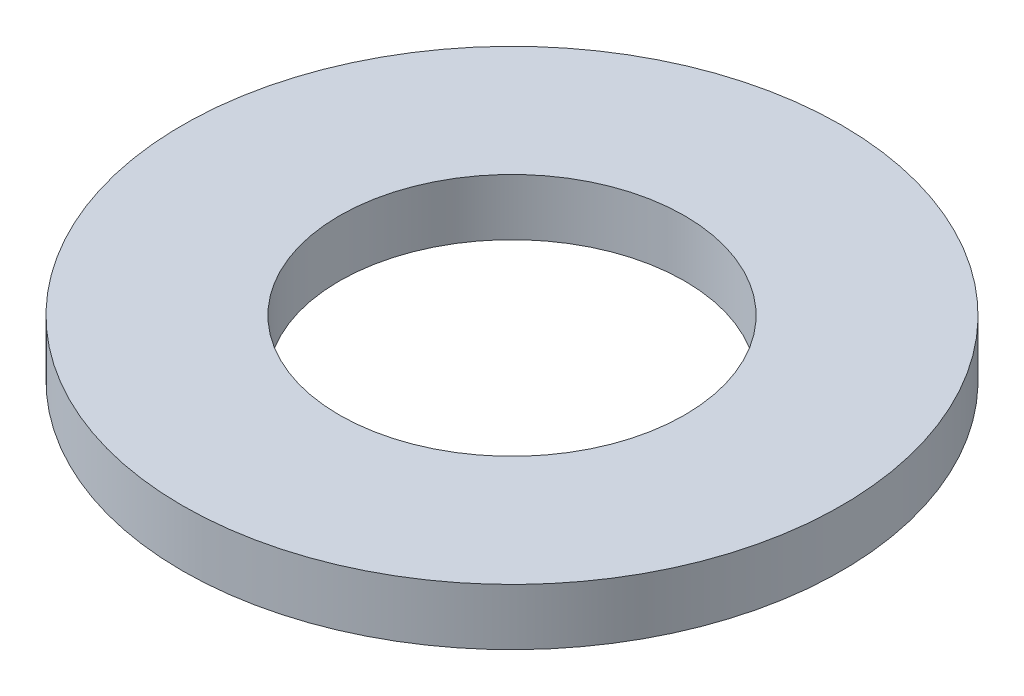
from build123d import *

# Parameters (mm, degrees)
SKETCH1_R           = 52.5
BOSS_EXTRUDE1_DEPTH = 9
SKETCH2_R           = 27.5
CUT_EXTRUDE1_DEPTH  = 75.789705174


with BuildPart() as part:
    # Sketch1 → Boss-Extrude1 (new body)
    with BuildSketch(Plane(origin=(0, 0, 0), x_dir=(1, 0, 0), z_dir=(0, 1, 0))):
        Circle(SKETCH1_R)
    extrude(amount=BOSS_EXTRUDE1_DEPTH)

    # Sketch2 → Cut-Extrude1 (cut, through all)
    with BuildSketch(Plane(origin=(0, 0, 0), x_dir=(1, 0, 0), z_dir=(0, 1, 0))):
        Circle(SKETCH2_R)
    extrude(amount=CUT_EXTRUDE1_DEPTH, mode=Mode.SUBTRACT)


solid = part.part
